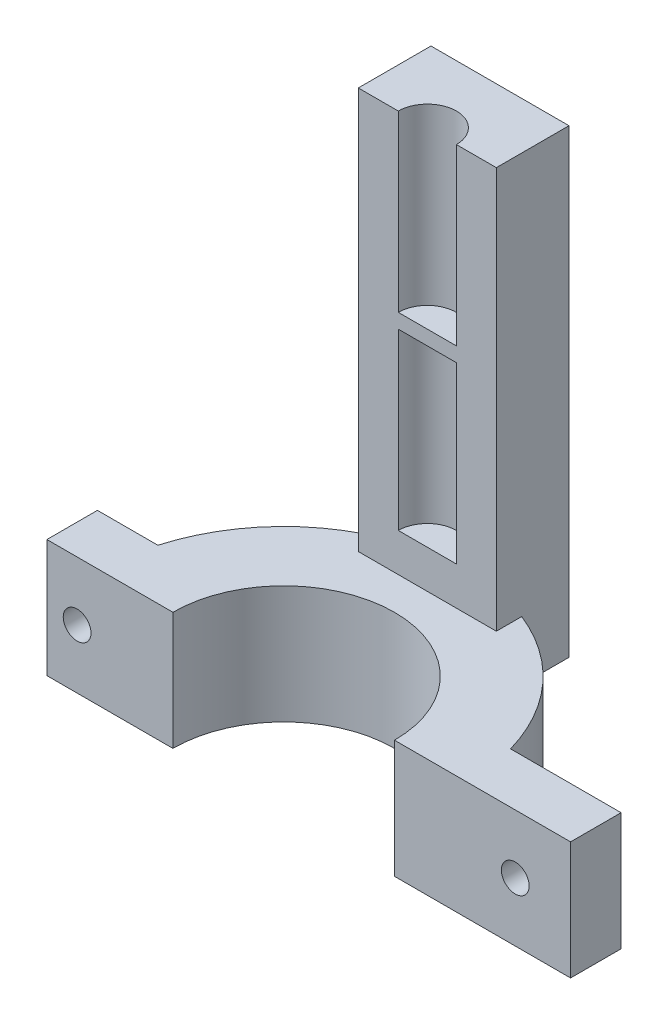
from build123d import *

# Parameters (mm, degrees)
SKETCH_1_W                = 50.28
SKETCH_1_H                = 34.2
SKETCH_1_W_2              = 30.28
SKETCH_1_H_2              = 14.2
EXTRUDE_1_DEPTH           = 12.25
SKETCH_4_W                = 13
SKETCH_4_H                = 13.91
EXTRUDE_1_2_DEPTH         = 74.82
SKETCH_5_W                = 13.91
SKETCH_5_H                = 16.23
EXTRUDE_2_DEPTH           = 16
SKETCH_7_R                = 25.25
SKETCH_7_R_2              = 15.25
EXTRUDE_2_2_DEPTH         = 16.23
SKETCH_15_R               = 1.91
CUT_EXTRUDE_6_DEPTH       = 97.964478439
SKETCH_18_W               = 49.344544624
SKETCH_18_H               = 6.125
CUT_EXTRUDE_8_DEPTH       = 101.789238284
SKETCH_19_W               = 34.2
SKETCH_19_H               = 6.125
CUT_EXTRUDE_9_DEPTH       = 10
SKETCH_21_R               = 1.91
CUT_EXTRUDE_10_DEPTH      = 10
SKETCH_20_R               = 1.91
CUT_EXTRUDE_11_DEPTH      = 10
FILLET_START              = -7.1
FILLET_1_DEPTH            = 14.2
FILLET_2_DEPTH            = 14.2
SKETCH_29_W               = 13.91
SKETCH_29_H               = 74.82
EXTRUDE_5_DEPTH           = 10
SKETCH_30_W               = 10
SKETCH_30_H               = 58.59
CUT_EXTRUDE_13_DEPTH      = 97.964478439
SKETCH_32_W               = 34.2
SKETCH_32_H               = 5.745736365
EXTRUDE_6_DEPTH           = 10
CUT_EXTRUDE_16_DEPTH      = 50
CUT_EXTRUDE_16_DEPTH_BACK = 50
SKETCH_38_W               = 116.985630298
SKETCH_38_H               = 80.538350638
SKETCH_41_W               = 13.91
SKETCH_41_H               = 5.745736365
EXTRUDE_7_DEPTH           = 3
SKETCH_42_W               = 13
SKETCH_42_H               = 13.91
EXTRUDE_8_DEPTH           = 74.82
SKETCH_43_W               = 13.91
SKETCH_43_H               = 16.23
EXTRUDE_9_DEPTH           = 15.22
SKETCH_44_R               = 1.91
CUT_EXTRUDE_17_DEPTH      = 15.22
SKETCH_46_R               = 25.25
SKETCH_46_R_2             = 15.25
EXTRUDE_6_2_DEPTH         = 16.23
EXTRUDE_10_DEPTH          = 7.22
EXTRUDE_10_DEPTH_BACK     = 10
SKETCH_47_W               = 13.91
SKETCH_47_H               = 16.23
SKETCH_50_W               = 3.056753925
SKETCH_50_H               = 16.23
CUT_EXTRUDE_18_DEPTH      = 96.578211037
SKETCH_51_R               = 1.91
CUT_EXTRUDE_19_DEPTH      = 95.015226304
CUT_EXTRUDE_21_DEPTH      = 95.015226304
CUT_EXTRUDE_21_DEPTH_BACK = 95.015226304
SKETCH_54_W               = 96.956660426
SKETCH_54_H               = 45.351296872
CUT_EXTRUDE_22_DEPTH      = 60
SKETCH_59_W               = 19
SKETCH_59_H               = 37.38
EXTRUDE_12_DEPTH          = 10
SKETCH_60_R               = 4
CUT_EXTRUDE_25_DEPTH      = 24
SKETCH_61_W               = 19
SKETCH_61_H               = 10
EXTRUDE_13_DEPTH          = 26
SKETCH_62_R               = 4
CUT_EXTRUDE_26_DEPTH      = 24


with BuildPart() as part:
    # 草圖1 → Extrude 1 (new body)
    with BuildSketch(Plane(origin=(0, 0, 0), x_dir=(1, 0, 0), z_dir=(0, 1, 0))):
        Rectangle(SKETCH_1_W, SKETCH_1_H)
        Rectangle(SKETCH_1_W_2, SKETCH_1_H_2, mode=Mode.SUBTRACT)
    extrude(amount=EXTRUDE_1_DEPTH)

    # 草圖4 → Extrude 1 2 (add)
    with BuildSketch(Plane.XZ):
        with Locations((18.64, 0)):
            Rectangle(SKETCH_4_W, SKETCH_4_H)
    extrude(amount=EXTRUDE_1_2_DEPTH)

    # 草圖5 → Extrude 2 (add)
    with BuildSketch(Plane.ZY.offset(-12.14)):
        with Locations((0, -66.705)):
            Rectangle(SKETCH_5_W, SKETCH_5_H)
    extrude(amount=EXTRUDE_2_DEPTH)

    # 草圖7 → Extrude 2 2 (add)
    with BuildSketch(Plane(origin=(3.626674765, -74.82, 0), x_dir=(1, 0, 0), z_dir=(0, -1, 0))):
        with Locations((-30.978154344, 0)):
            Circle(SKETCH_7_R)
        with Locations((-30.978154344, 0)):
            Circle(SKETCH_7_R_2, mode=Mode.SUBTRACT)
    extrude(amount=-EXTRUDE_2_2_DEPTH)

    # 草圖15 → 除料-伸長6 (cut, through all)
    with BuildSketch(Plane(origin=(0, 0, -6.955), x_dir=(-1, 0, 0), z_dir=(0, 0, -1))):
        with Locations((-4.530883248, -66.705)):
            Circle(SKETCH_15_R)
    extrude(amount=-CUT_EXTRUDE_6_DEPTH, mode=Mode.SUBTRACT)

    # 草圖18 → 除料-伸長8 (cut, through all)
    with BuildSketch(Plane(origin=(0, 0, -17.1), x_dir=(-1, 0, 0), z_dir=(0, 0, -1))):
        with Locations((0.467727688, 9.1875)):
            Rectangle(SKETCH_18_W, SKETCH_18_H)
    extrude(amount=-CUT_EXTRUDE_8_DEPTH, mode=Mode.SUBTRACT)

    # 草圖19 → 除料-伸長9 (cut)
    with BuildSketch(Plane.ZY.offset(-24.204544624)):
        with Locations((0, 9.1875)):
            Rectangle(SKETCH_19_W, SKETCH_19_H)
    extrude(amount=-CUT_EXTRUDE_9_DEPTH, mode=Mode.SUBTRACT)

    # 草圖21 → 除料-伸長10 (cut)
    with BuildSketch(Plane(origin=(0, 6.125, 0), x_dir=(1, 0, 0), z_dir=(0, 1, 0))):
        with Locations(Location((17.69, 0, 0), (0, 0, 270))):
            Circle(SKETCH_21_R)
    extrude(amount=-CUT_EXTRUDE_10_DEPTH, mode=Mode.SUBTRACT)

    # 草圖20 → 除料-伸長11 (cut)
    with BuildSketch(Plane(origin=(0, 6.125, 0), x_dir=(1, 0, 0), z_dir=(0, 1, 0))):
        with Locations(Location((-17.395, 0, 0), (0, 0, 270))):
            Circle(SKETCH_20_R)
    extrude(amount=-CUT_EXTRUDE_11_DEPTH, mode=Mode.SUBTRACT)

    # 圓角1: read off the stored shape, not the designer's step
    # 圓角1 outline → 圓角1 (cut)
    with BuildSketch(Plane.XY.offset(FILLET_START)):
        with BuildLine():
            add(Edge.make_bspline(
                [(-15.14, 0), (-21.974170252, 5.199829476), (-25.14, 5.745736365)],
                knots=[0, 0, 0, 0.664102345, 0.664102345, 0.664102345], degree=2, weights=[1, 2.223777218, 1.822127795]))
            Line((-15.14, 0), (-15.14, 6.125))
            Line((-15.14, 6.125), (-25.14, 6.125))
            Line((-25.14, 6.125), (-25.14, 5.745736365))
        make_face()
    extrude(amount=FILLET_1_DEPTH, mode=Mode.SUBTRACT)

    # 圓角2: read off the stored shape, not the designer's step
    # 圓角2 outline → 圓角2 (cut)
    with BuildSketch(Plane.XY.offset(FILLET_START)):
        with BuildLine():
            Line((15.14, 6.125), (15.14, 0))
            add(Edge.make_bspline(
                [(15.14, 0), (21.974170252, 5.199829476), (25.14, 5.745736365)],
                knots=[0, 0, 0, 0.664102345, 0.664102345, 0.664102345], degree=2, weights=[1, 2.223777218, 1.822127795]))
            Line((25.14, 5.745736365), (25.14, 6.125))
            Line((25.14, 6.125), (15.14, 6.125))
        make_face()
    extrude(amount=FILLET_2_DEPTH, mode=Mode.SUBTRACT)

    # 草圖29 → 填料-伸長5 (add)
    with BuildSketch(Plane(origin=(25.14, 0, 0), x_dir=(0, 0, -1), z_dir=(1, 0, 0))):
        with Locations((0, -37.41)):
            Rectangle(SKETCH_29_W, SKETCH_29_H)
    extrude(amount=EXTRUDE_5_DEPTH)

    # 草圖30 → 除料-伸長13 (cut, through all)
    with BuildSketch(Plane.XY.offset(6.955)):
        with Locations((17.14, -29.295)):
            Rectangle(SKETCH_30_W, SKETCH_30_H)
    extrude(amount=-CUT_EXTRUDE_13_DEPTH, mode=Mode.SUBTRACT)

    # 草圖32 → Extrude 6 (add)
    with BuildSketch(Plane(origin=(25.14, 0, 0), x_dir=(0, 0, -1), z_dir=(1, 0, 0))):
        with Locations((0, 2.872868182)):
            Rectangle(SKETCH_32_W, SKETCH_32_H)
    extrude(amount=EXTRUDE_6_DEPTH)

    # 草圖38 → 除料-伸長16 (cut, two sides: drawn at the far end of the back side and taken through both)
    with BuildSketch(Plane(origin=(0, 0, -6.955), x_dir=(-1, 0, 0), z_dir=(0, 0, -1)).offset(-CUT_EXTRUDE_16_DEPTH_BACK)):
        with Locations((7.268869252, -40.269175319)):
            Rectangle(SKETCH_38_W, SKETCH_38_H)
    extrude(amount=CUT_EXTRUDE_16_DEPTH + CUT_EXTRUDE_16_DEPTH_BACK, mode=Mode.SUBTRACT)

    # 草圖41 → 填料-伸長7 (add)
    with BuildSketch(Plane(origin=(35.14, 0, 0), x_dir=(0, 0, -1), z_dir=(1, 0, 0))):
        with Locations((0, 2.872868182)):
            Rectangle(SKETCH_41_W, SKETCH_41_H)
    extrude(amount=EXTRUDE_7_DEPTH)

    # 草圖42 → 填料-伸長8 (add)
    with BuildSketch(Plane(origin=(0, 0, 0), x_dir=(-1, 0, 0), z_dir=(0, -1, 0))):
        with Locations((-31.64, 0)):
            Rectangle(SKETCH_42_W, SKETCH_42_H)
    extrude(amount=EXTRUDE_8_DEPTH)

    # 草圖43 → 填料-伸長9 (add)
    with BuildSketch(Plane.ZY.offset(-25.14)):
        with Locations((0, -66.705)):
            Rectangle(SKETCH_43_W, SKETCH_43_H)
    extrude(amount=EXTRUDE_9_DEPTH)

    # 草圖44 → 除料-伸長17 (cut)
    with BuildSketch(Plane(origin=(0, 0, -6.955), x_dir=(-1, 0, 0), z_dir=(0, 0, -1))):
        with Locations(Location((-17.524895264, -66.705, 0), (0, 0, 90))):
            Circle(SKETCH_44_R)
    extrude(amount=-CUT_EXTRUDE_17_DEPTH, mode=Mode.SUBTRACT)

    # 草圖46 → Extrude 6 2 (add)
    with BuildSketch(Plane(origin=(0, -58.59, 0), x_dir=(1, 0, 0), z_dir=(0, 1, 0))):
        with Locations((-14.35, 0)):
            Circle(SKETCH_46_R)
        with Locations((-14.35, 0)):
            Circle(SKETCH_46_R_2, mode=Mode.SUBTRACT)
    extrude(amount=-EXTRUDE_6_2_DEPTH)

    # 草圖47 → 填料-伸長10 (add, two sides: drawn at the far end of the back side and taken through both)
    with BuildSketch(Plane(origin=(-40, 0, 0), x_dir=(0, 0, -1), z_dir=(1, 0, 0)).offset(-EXTRUDE_10_DEPTH_BACK)):
        with Locations((0, -66.705)):
            Rectangle(SKETCH_47_W, SKETCH_47_H)
    extrude(amount=EXTRUDE_10_DEPTH + EXTRUDE_10_DEPTH_BACK)

    # 草圖50 → 除料-伸長18 (cut, through all)
    with BuildSketch(Plane(origin=(0, 0, -6.955), x_dir=(-1, 0, 0), z_dir=(0, 0, -1))):
        with Locations((48.471623038, -66.705)):
            Rectangle(SKETCH_50_W, SKETCH_50_H)
    extrude(amount=-CUT_EXTRUDE_18_DEPTH, mode=Mode.SUBTRACT)

    # 草圖51 → 除料-伸長19 (cut, through all)
    with BuildSketch(Plane(origin=(0, 0, -6.955), x_dir=(-1, 0, 0), z_dir=(0, 0, -1))):
        with Locations((42.786508152, -66.705)):
            Circle(SKETCH_51_R)
    extrude(amount=-CUT_EXTRUDE_19_DEPTH, mode=Mode.SUBTRACT)

    # 草圖53 → 除料-伸長21 (cut, two sides: drawn at the far end of the back side and taken through both)
    with BuildSketch(Plane.XY.offset(6.955).offset(-CUT_EXTRUDE_21_DEPTH_BACK)):
        Polygon((25.14, -58.59), (25.14, -81.637244924), (42.795360098, -81.637244924), (56.21630317, 11.638309425), (-41.644740061, 8.95412081), (-39.519757408, -16.545671026), (25.14, -20.795636332), align=None)
    extrude(amount=CUT_EXTRUDE_21_DEPTH + CUT_EXTRUDE_21_DEPTH_BACK, mode=Mode.SUBTRACT)

    # 草圖54 → 除料-伸長22 (cut)
    with BuildSketch(Plane(origin=(0, -58.59, 0), x_dir=(1, 0, 0), z_dir=(0, 1, 0))):
        with Locations((-23.338330213, -22.675648436)):
            Rectangle(SKETCH_54_W, SKETCH_54_H)
    extrude(amount=-CUT_EXTRUDE_22_DEPTH, mode=Mode.SUBTRACT)

    # 草圖59 → 填料-伸長12 (add)
    with BuildSketch(Plane.XY.offset(-30)):
        with Locations((-14.576753925, -48.015)):
            Rectangle(SKETCH_59_W, SKETCH_59_H)
    extrude(amount=EXTRUDE_12_DEPTH)

    # 草圖60 → 除料-伸長25 (cut)
    with BuildSketch(Plane(origin=(0, -29.325, 0), x_dir=(1, 0, 0), z_dir=(0, 1, 0))):
        with Locations((-14.576753925, 20)):
            Circle(SKETCH_60_R)
    extrude(amount=-CUT_EXTRUDE_25_DEPTH, mode=Mode.SUBTRACT)

    # 草圖61 → 填料-伸長13 (add)
    with BuildSketch(Plane(origin=(0, -29.325, 0), x_dir=(1, 0, 0), z_dir=(0, 1, 0))):
        with Locations((-14.576753925, 25)):
            Rectangle(SKETCH_61_W, SKETCH_61_H)
    extrude(amount=EXTRUDE_13_DEPTH)

    # 草圖62 → 除料-伸長26 (cut)
    with BuildSketch(Plane(origin=(0, -3.325, 0), x_dir=(1, 0, 0), z_dir=(0, 1, 0))):
        with Locations((-14.576753925, 20)):
            Circle(SKETCH_62_R)
    extrude(amount=-CUT_EXTRUDE_26_DEPTH, mode=Mode.SUBTRACT)


solid = part.part
